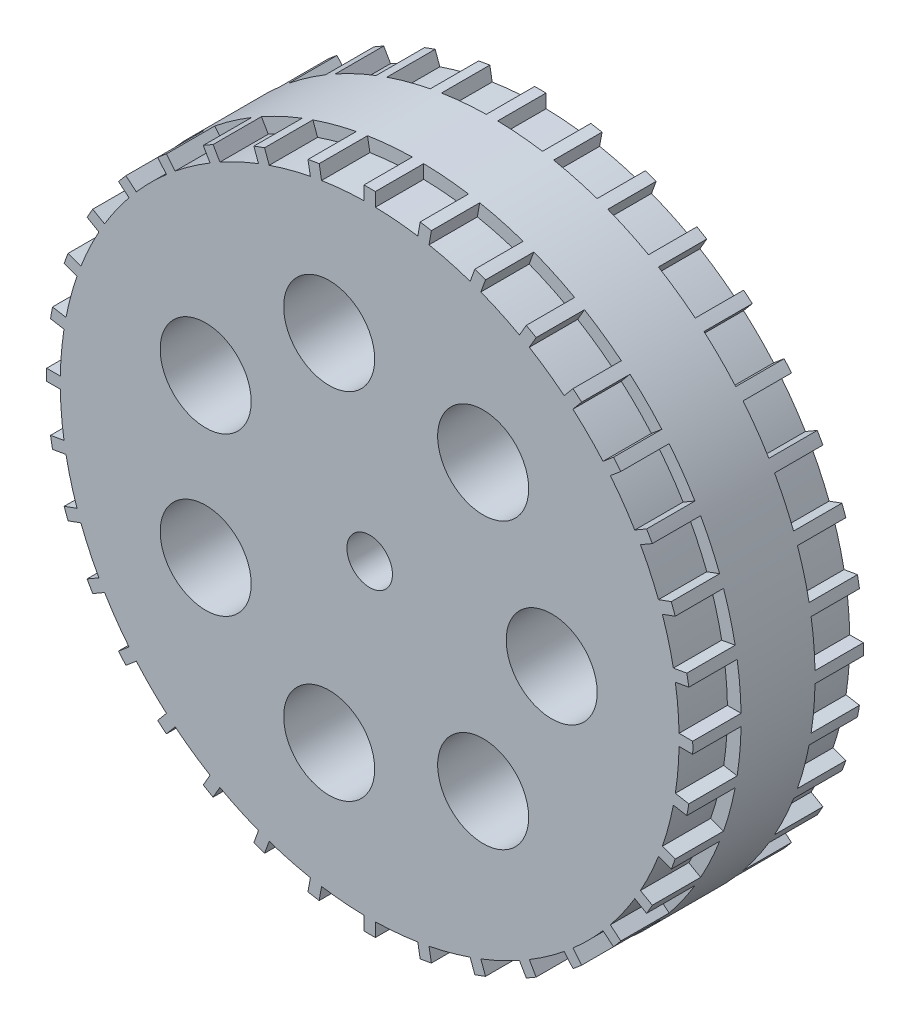
from build123d import *
from build123d.topology import SkipClean

# Parameters (mm, degrees)
SKETCH_1_R          = 27.2
EXTRUDE_1_DEPTH     = 15
CUT_EXTRUDE_1_DEPTH = 10
SKETCH_3_R          = 2
CUT_EXTRUDE_2_DEPTH = 11
SKETCH_6_R          = 4
CUT_EXTRUDE_5_DEPTH = 30
EXTRUDE_START       = -15
EXTRUDE_2_DEPTH     = 15
SKETCH_10_R         = 28.4
SKETCH_10_R_2       = 27.2
EXTRUDE_3_DEPTH     = 3.25


with BuildPart() as part:
    # 草图1 → 凸台-拉伸1 (new body)
    with BuildSketch(Plane.XY):
        Circle(SKETCH_1_R)
    extrude(amount=EXTRUDE_1_DEPTH)

    # 草图2 → 切除-拉伸1 (cut)
    with BuildSketch(Plane(origin=(0, 0, 0), x_dir=(-1, 0, 0), z_dir=(0, 0, -1))):
        Polygon((7.043673284, 0), (3.521836642, 6.1), (-3.521836642, 6.1), (-7.043673284, 0), (-3.521836642, -6.1), (3.521836642, -6.1), align=None)
    extrude(amount=-CUT_EXTRUDE_1_DEPTH, mode=Mode.SUBTRACT)

    # 草图3 → 切除-拉伸2 (cut)
    with BuildSketch(Plane(origin=(0, 0, 10), x_dir=(-1, 0, 0), z_dir=(0, 0, -1))):
        Circle(SKETCH_3_R)
    extrude(amount=-CUT_EXTRUDE_2_DEPTH, mode=Mode.SUBTRACT)

    # 草图6 → 切除-拉伸5 (cut)
    with BuildSketch(Plane.XY.offset(15)):
        with Locations((16, 0)):
            Circle(SKETCH_6_R)
        with Locations((9.97583683, -12.509303719)):
            Circle(SKETCH_6_R)
        with Locations((-3.560334943, -15.598846595)):
            Circle(SKETCH_6_R)
        with Locations((-14.415501886, -6.942139826)):
            Circle(SKETCH_6_R)
        with Locations((-14.415501886, 6.942139826)):
            Circle(SKETCH_6_R)
        with Locations((-3.560334943, 15.598846595)):
            Circle(SKETCH_6_R)
        with Locations((9.97583683, 12.509303719)):
            Circle(SKETCH_6_R)
    extrude(amount=-CUT_EXTRUDE_5_DEPTH, mode=Mode.SUBTRACT)

    # 草图7 → 凸台-拉伸2 (add)
    with BuildSketch(Plane.XY.offset(15).offset(EXTRUDE_START)):
        with BuildLine():
            Line((-0.5, 28.39559825), (-0.5, 27.195404023))
            ThreePointArc((-0.5, 27.195404023), (0, 27.2), (0.5, 27.195404023))
            Line((0.5, 27.195404023), (0.5, 28.39559825))
            ThreePointArc((0.5, 28.39559825), (0, 28.4), (-0.5, 28.39559825))
        make_face()
        with BuildLine():
            Line((4.438440013, 28.051029397), (4.230028473, 26.869068817))
            ThreePointArc((4.230028473, 26.869068817), (4.723230433, 26.786770882), (5.214836226, 26.69542064))
            Line((5.214836226, 26.69542064), (5.423247766, 27.87738122))
            ThreePointArc((5.423247766, 27.87738122), (4.931608246, 27.968540186), (4.438440013, 28.051029397))
        make_face()
        with BuildLine():
            Line((9.242020273, 26.85414421), (8.831529672, 25.726330552))
            ThreePointArc((8.831529672, 25.726330552), (9.302947898, 25.559639285), (9.771222292, 25.384310408))
            Line((9.771222292, 25.384310408), (10.181712894, 26.512124067))
            ThreePointArc((10.181712894, 26.512124067), (9.71337207, 26.68727043), (9.242020273, 26.85414421))
        make_face()
        with BuildLine():
            Line((13.764786423, 24.841309441), (13.16468931, 23.801910751))
            ThreePointArc((13.16468931, 23.801910751), (13.6, 23.555890983), (14.030714714, 23.301910751))
            Line((14.030714714, 23.301910751), (14.630811827, 24.341309441))
            ThreePointArc((14.630811827, 24.341309441), (14.2, 24.595121467), (13.764786423, 24.841309441))
        make_face()
        with BuildLine():
            Line((17.869316503, 22.073684054), (17.097846525, 21.154281935))
            ThreePointArc((17.097846525, 21.154281935), (17.483822983, 20.836408853), (17.863890968, 20.511494326))
            Line((17.863890968, 20.511494326), (18.635360947, 21.430896444))
            ThreePointArc((18.635360947, 21.430896444), (18.255168115, 21.755662185), (17.869316503, 22.073684054))
        make_face()
        with BuildLine():
            Line((21.430896444, 18.635360947), (20.511494326, 17.863890968))
            ThreePointArc((20.511494326, 17.863890968), (20.836408853, 17.483822983), (21.154281935, 17.097846525))
            Line((21.154281935, 17.097846525), (22.073684054, 17.869316503))
            ThreePointArc((22.073684054, 17.869316503), (21.755662185, 18.255168115), (21.430896444, 18.635360947))
        make_face()
        with BuildLine():
            Line((24.341309441, 14.630811827), (23.301910751, 14.030714714))
            ThreePointArc((23.301910751, 14.030714714), (23.555890983, 13.6), (23.801910751, 13.16468931))
            Line((23.801910751, 13.16468931), (24.841309441, 13.764786423))
            ThreePointArc((24.841309441, 13.764786423), (24.595121467, 14.2), (24.341309441, 14.630811827))
        make_face()
        with BuildLine():
            Line((26.512124067, 10.181712894), (25.384310408, 9.771222292))
            ThreePointArc((25.384310408, 9.771222292), (25.559639285, 9.302947898), (25.726330552, 8.831529672))
            Line((25.726330552, 8.831529672), (26.85414421, 9.242020273))
            ThreePointArc((26.85414421, 9.242020273), (26.68727043, 9.71337207), (26.512124067, 10.181712894))
        make_face()
        with BuildLine():
            Line((27.87738122, 5.423247766), (26.69542064, 5.214836226))
            ThreePointArc((26.69542064, 5.214836226), (26.786770882, 4.723230433), (26.869068817, 4.230028473))
            Line((26.869068817, 4.230028473), (28.051029397, 4.438440013))
            ThreePointArc((28.051029397, 4.438440013), (27.968540186, 4.931608246), (27.87738122, 5.423247766))
        make_face()
        with BuildLine():
            Line((28.39559825, 0.5), (27.195404023, 0.5))
            ThreePointArc((27.195404023, 0.5), (27.2, 0), (27.195404023, -0.5))
            Line((27.195404023, -0.5), (28.39559825, -0.5))
            ThreePointArc((28.39559825, -0.5), (28.4, 0), (28.39559825, 0.5))
        make_face()
        with BuildLine():
            Line((28.051029397, -4.438440013), (26.869068817, -4.230028473))
            ThreePointArc((26.869068817, -4.230028473), (26.786770882, -4.723230433), (26.69542064, -5.214836226))
            Line((26.69542064, -5.214836226), (27.87738122, -5.423247766))
            ThreePointArc((27.87738122, -5.423247766), (27.968540186, -4.931608246), (28.051029397, -4.438440013))
        make_face()
        with BuildLine():
            Line((26.85414421, -9.242020273), (25.726330552, -8.831529672))
            ThreePointArc((25.726330552, -8.831529672), (25.559639285, -9.302947898), (25.384310408, -9.771222292))
            Line((25.384310408, -9.771222292), (26.512124067, -10.181712894))
            ThreePointArc((26.512124067, -10.181712894), (26.68727043, -9.71337207), (26.85414421, -9.242020273))
        make_face()
        with BuildLine():
            Line((24.841309441, -13.764786423), (23.801910751, -13.16468931))
            ThreePointArc((23.801910751, -13.16468931), (23.555890983, -13.6), (23.301910751, -14.030714714))
            Line((23.301910751, -14.030714714), (24.341309441, -14.630811827))
            ThreePointArc((24.341309441, -14.630811827), (24.595121467, -14.2), (24.841309441, -13.764786423))
        make_face()
        with BuildLine():
            Line((22.073684054, -17.869316503), (21.154281935, -17.097846525))
            ThreePointArc((21.154281935, -17.097846525), (20.836408853, -17.483822983), (20.511494326, -17.863890968))
            Line((20.511494326, -17.863890968), (21.430896444, -18.635360947))
            ThreePointArc((21.430896444, -18.635360947), (21.755662185, -18.255168115), (22.073684054, -17.869316503))
        make_face()
        with BuildLine():
            Line((18.635360947, -21.430896444), (17.863890968, -20.511494326))
            ThreePointArc((17.863890968, -20.511494326), (17.483822983, -20.836408853), (17.097846525, -21.154281935))
            Line((17.097846525, -21.154281935), (17.869316503, -22.073684054))
            ThreePointArc((17.869316503, -22.073684054), (18.255168115, -21.755662185), (18.635360947, -21.430896444))
        make_face()
        with BuildLine():
            Line((14.630811827, -24.341309441), (14.030714714, -23.301910751))
            ThreePointArc((14.030714714, -23.301910751), (13.6, -23.555890983), (13.16468931, -23.801910751))
            Line((13.16468931, -23.801910751), (13.764786423, -24.841309441))
            ThreePointArc((13.764786423, -24.841309441), (14.2, -24.595121467), (14.630811827, -24.341309441))
        make_face()
        with BuildLine():
            Line((10.181712894, -26.512124067), (9.771222292, -25.384310408))
            ThreePointArc((9.771222292, -25.384310408), (9.302947898, -25.559639285), (8.831529672, -25.726330552))
            Line((8.831529672, -25.726330552), (9.242020273, -26.85414421))
            ThreePointArc((9.242020273, -26.85414421), (9.71337207, -26.68727043), (10.181712894, -26.512124067))
        make_face()
        with BuildLine():
            Line((5.423247766, -27.87738122), (5.214836226, -26.69542064))
            ThreePointArc((5.214836226, -26.69542064), (4.723230433, -26.786770882), (4.230028473, -26.869068817))
            Line((4.230028473, -26.869068817), (4.438440013, -28.051029397))
            ThreePointArc((4.438440013, -28.051029397), (4.931608246, -27.968540186), (5.423247766, -27.87738122))
        make_face()
        with BuildLine():
            Line((0.5, -28.39559825), (0.5, -27.195404023))
            ThreePointArc((0.5, -27.195404023), (0, -27.2), (-0.5, -27.195404023))
            Line((-0.5, -27.195404023), (-0.5, -28.39559825))
            ThreePointArc((-0.5, -28.39559825), (0, -28.4), (0.5, -28.39559825))
        make_face()
        with BuildLine():
            Line((-4.438440013, -28.051029397), (-4.230028473, -26.869068817))
            ThreePointArc((-4.230028473, -26.869068817), (-4.723230433, -26.786770882), (-5.214836226, -26.69542064))
            Line((-5.214836226, -26.69542064), (-5.423247766, -27.87738122))
            ThreePointArc((-5.423247766, -27.87738122), (-4.931608246, -27.968540186), (-4.438440013, -28.051029397))
        make_face()
        with BuildLine():
            Line((-9.242020273, -26.85414421), (-8.831529672, -25.726330552))
            ThreePointArc((-8.831529672, -25.726330552), (-9.302947898, -25.559639285), (-9.771222292, -25.384310408))
            Line((-9.771222292, -25.384310408), (-10.181712894, -26.512124067))
            ThreePointArc((-10.181712894, -26.512124067), (-9.71337207, -26.68727043), (-9.242020273, -26.85414421))
        make_face()
        with BuildLine():
            Line((-13.764786423, -24.841309441), (-13.16468931, -23.801910751))
            ThreePointArc((-13.16468931, -23.801910751), (-13.6, -23.555890983), (-14.030714714, -23.301910751))
            Line((-14.030714714, -23.301910751), (-14.630811827, -24.341309441))
            ThreePointArc((-14.630811827, -24.341309441), (-14.2, -24.595121467), (-13.764786423, -24.841309441))
        make_face()
        with BuildLine():
            Line((-17.869316503, -22.073684054), (-17.097846525, -21.154281935))
            ThreePointArc((-17.097846525, -21.154281935), (-17.483822983, -20.836408853), (-17.863890968, -20.511494326))
            Line((-17.863890968, -20.511494326), (-18.635360947, -21.430896444))
            ThreePointArc((-18.635360947, -21.430896444), (-18.255168115, -21.755662185), (-17.869316503, -22.073684054))
        make_face()
        with BuildLine():
            Line((-21.430896444, -18.635360947), (-20.511494326, -17.863890968))
            ThreePointArc((-20.511494326, -17.863890968), (-20.836408853, -17.483822983), (-21.154281935, -17.097846525))
            Line((-21.154281935, -17.097846525), (-22.073684054, -17.869316503))
            ThreePointArc((-22.073684054, -17.869316503), (-21.755662185, -18.255168115), (-21.430896444, -18.635360947))
        make_face()
        with BuildLine():
            Line((-24.341309441, -14.630811827), (-23.301910751, -14.030714714))
            ThreePointArc((-23.301910751, -14.030714714), (-23.555890983, -13.6), (-23.801910751, -13.16468931))
            Line((-23.801910751, -13.16468931), (-24.841309441, -13.764786423))
            ThreePointArc((-24.841309441, -13.764786423), (-24.595121467, -14.2), (-24.341309441, -14.630811827))
        make_face()
        with BuildLine():
            Line((-26.512124067, -10.181712894), (-25.384310408, -9.771222292))
            ThreePointArc((-25.384310408, -9.771222292), (-25.559639285, -9.302947898), (-25.726330552, -8.831529672))
            Line((-25.726330552, -8.831529672), (-26.85414421, -9.242020273))
            ThreePointArc((-26.85414421, -9.242020273), (-26.68727043, -9.71337207), (-26.512124067, -10.181712894))
        make_face()
        with BuildLine():
            Line((-27.87738122, -5.423247766), (-26.69542064, -5.214836226))
            ThreePointArc((-26.69542064, -5.214836226), (-26.786770882, -4.723230433), (-26.869068817, -4.230028473))
            Line((-26.869068817, -4.230028473), (-28.051029397, -4.438440013))
            ThreePointArc((-28.051029397, -4.438440013), (-27.968540186, -4.931608246), (-27.87738122, -5.423247766))
        make_face()
        with BuildLine():
            Line((-28.39559825, -0.5), (-27.195404023, -0.5))
            ThreePointArc((-27.195404023, -0.5), (-27.2, 0), (-27.195404023, 0.5))
            Line((-27.195404023, 0.5), (-28.39559825, 0.5))
            ThreePointArc((-28.39559825, 0.5), (-28.4, 0), (-28.39559825, -0.5))
        make_face()
        with BuildLine():
            Line((-28.051029397, 4.438440013), (-26.869068817, 4.230028473))
            ThreePointArc((-26.869068817, 4.230028473), (-26.786770882, 4.723230433), (-26.69542064, 5.214836226))
            Line((-26.69542064, 5.214836226), (-27.87738122, 5.423247766))
            ThreePointArc((-27.87738122, 5.423247766), (-27.968540186, 4.931608246), (-28.051029397, 4.438440013))
        make_face()
        with BuildLine():
            Line((-26.85414421, 9.242020273), (-25.726330552, 8.831529672))
            ThreePointArc((-25.726330552, 8.831529672), (-25.559639285, 9.302947898), (-25.384310408, 9.771222292))
            Line((-25.384310408, 9.771222292), (-26.512124067, 10.181712894))
            ThreePointArc((-26.512124067, 10.181712894), (-26.68727043, 9.71337207), (-26.85414421, 9.242020273))
        make_face()
        with BuildLine():
            Line((-24.841309441, 13.764786423), (-23.801910751, 13.16468931))
            ThreePointArc((-23.801910751, 13.16468931), (-23.555890983, 13.6), (-23.301910751, 14.030714714))
            Line((-23.301910751, 14.030714714), (-24.341309441, 14.630811827))
            ThreePointArc((-24.341309441, 14.630811827), (-24.595121467, 14.2), (-24.841309441, 13.764786423))
        make_face()
        with BuildLine():
            Line((-22.073684054, 17.869316503), (-21.154281935, 17.097846525))
            ThreePointArc((-21.154281935, 17.097846525), (-20.836408853, 17.483822983), (-20.511494326, 17.863890968))
            Line((-20.511494326, 17.863890968), (-21.430896444, 18.635360947))
            ThreePointArc((-21.430896444, 18.635360947), (-21.755662185, 18.255168115), (-22.073684054, 17.869316503))
        make_face()
        with BuildLine():
            Line((-18.635360947, 21.430896444), (-17.863890968, 20.511494326))
            ThreePointArc((-17.863890968, 20.511494326), (-17.483822983, 20.836408853), (-17.097846525, 21.154281935))
            Line((-17.097846525, 21.154281935), (-17.869316503, 22.073684054))
            ThreePointArc((-17.869316503, 22.073684054), (-18.255168115, 21.755662185), (-18.635360947, 21.430896444))
        make_face()
        with BuildLine():
            Line((-14.630811827, 24.341309441), (-14.030714714, 23.301910751))
            ThreePointArc((-14.030714714, 23.301910751), (-13.6, 23.555890983), (-13.16468931, 23.801910751))
            Line((-13.16468931, 23.801910751), (-13.764786423, 24.841309441))
            ThreePointArc((-13.764786423, 24.841309441), (-14.2, 24.595121467), (-14.630811827, 24.341309441))
        make_face()
        with BuildLine():
            Line((-10.181712894, 26.512124067), (-9.771222292, 25.384310408))
            ThreePointArc((-9.771222292, 25.384310408), (-9.302947898, 25.559639285), (-8.831529672, 25.726330552))
            Line((-8.831529672, 25.726330552), (-9.242020273, 26.85414421))
            ThreePointArc((-9.242020273, 26.85414421), (-9.71337207, 26.68727043), (-10.181712894, 26.512124067))
        make_face()
        with BuildLine():
            Line((-5.423247766, 27.87738122), (-5.214836226, 26.69542064))
            ThreePointArc((-5.214836226, 26.69542064), (-4.723230433, 26.786770882), (-4.230028473, 26.869068817))
            Line((-4.230028473, 26.869068817), (-4.438440013, 28.051029397))
            ThreePointArc((-4.438440013, 28.051029397), (-4.931608246, 27.968540186), (-5.423247766, 27.87738122))
        make_face()
    extrude(amount=EXTRUDE_2_DEPTH)

    # 草图10 → 凸台-拉伸3 (add)
    with SkipClean():  # the faces are left unmerged after this step: merging them gives an invalid solid
        with BuildSketch(Plane.XY.offset(7.5)):
            with Locations(Location((0, 0, 0), (0, 0, 1.00878063))):
                Circle(SKETCH_10_R)
            Circle(SKETCH_10_R_2, mode=Mode.SUBTRACT)
        extrude_3 = extrude(amount=EXTRUDE_3_DEPTH)

    # 镜向1: 凸台-拉伸3 across plane
    add(extrude_3.mirror(Plane.XY.offset(7.5)))


solid = part.part
